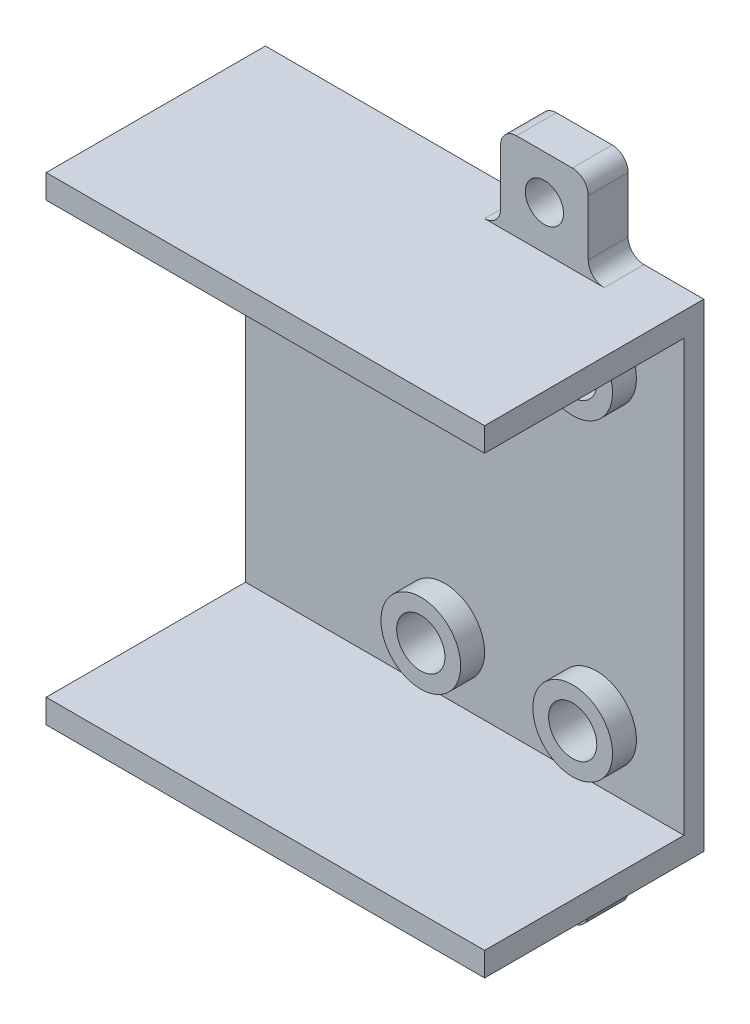
from build123d import *

# Parameters (mm, degrees)
SKETCH1_W            = 55
SKETCH1_H            = 60
BOSS_EXTRUDE1_DEPTH  = 2.5
SKETCH2_W            = 55
SKETCH2_H            = 3
BOSS_EXTRUDE2_DEPTH  = 25
SKETCH3_R            = 5
SKETCH3_R_2          = 3.025
BOSS_EXTRUDE3_DEPTH  = 3
CUT_EXTRUDE1_START   = -2
SKETCH4_R            = 3.025
CUT_EXTRUDE1_DEPTH   = 2
SKETCH5_W            = 11
SKETCH5_H            = 11
BOSS_EXTRUDE4_DEPTH  = 5
M4_CLEARANCE_HOLE1_D = 4.8
FILLET3_R            = 2


with BuildPart() as part:
    # Sketch1 → Boss-Extrude1 (new body)
    with BuildSketch(Plane.XY):
        Rectangle(SKETCH1_W, SKETCH1_H)
    extrude(amount=BOSS_EXTRUDE1_DEPTH)

    # Sketch2 → Boss-Extrude2 (add)
    with BuildSketch(Plane.XY.offset(2.5)):
        with Locations((0, 28.5)):
            Rectangle(SKETCH2_W, SKETCH2_H)
        with Locations((0, -28.5)):
            Rectangle(SKETCH2_W, SKETCH2_H)
    extrude(amount=BOSS_EXTRUDE2_DEPTH)

    # Sketch3 → Boss-Extrude3 (add)
    # profile 1 of 4: a face of its own
    with BuildSketch(Plane.XY.offset(2.5)):
        with Locations((-2.504, 19.6215)):
            Circle(SKETCH3_R)
        with Locations((-2.504, 19.6215)):
            Circle(SKETCH3_R_2, mode=Mode.SUBTRACT)
    # profile 2 of 4: a face of its own
    with BuildSketch(Plane.XY.offset(2.5)):
        with Locations((16.546, 19.6215)):
            Circle(SKETCH3_R)
        with Locations((16.546, 19.6215)):
            Circle(SKETCH3_R_2, mode=Mode.SUBTRACT)
    # profile 3 of 4: a face of its own
    with BuildSketch(Plane.XY.offset(2.5)):
        with Locations((16.546, -19.6215)):
            Circle(SKETCH3_R)
        with Locations((16.546, -19.6215)):
            Circle(SKETCH3_R_2, mode=Mode.SUBTRACT)
    # profile 4 of 4: a face of its own
    with BuildSketch(Plane.XY.offset(2.5)):
        with Locations((-2.504, -19.6215)):
            Circle(SKETCH3_R)
        with Locations((-2.504, -19.6215)):
            Circle(SKETCH3_R_2, mode=Mode.SUBTRACT)
    extrude(amount=BOSS_EXTRUDE3_DEPTH)

    # Sketch4 → Cut-Extrude1 (cut)
    with BuildSketch(Plane.XY.offset(2.5).offset(CUT_EXTRUDE1_START)):
        with Locations((16.546, -19.6215)):
            Circle(SKETCH4_R)
        with Locations((-2.504, -19.6215)):
            Circle(SKETCH4_R)
        with Locations((16.546, 19.6215)):
            Circle(SKETCH4_R)
        with Locations((-2.504, 19.6215)):
            Circle(SKETCH4_R)
    extrude(amount=CUT_EXTRUDE1_DEPTH, mode=Mode.SUBTRACT)

    # Sketch5 → Boss-Extrude4 (add)
    with BuildSketch(Plane(origin=(0, 0, 0), x_dir=(-1, 0, 0), z_dir=(0, 0, -1))):
        with Locations((-12.5, 35.5)):
            Rectangle(SKETCH5_W, SKETCH5_H)
    boss_extrude4 = extrude(amount=-BOSS_EXTRUDE4_DEPTH)

    # M4 Clearance Hole1 (through all)
    with Locations(Plane.XY.offset(5)):
        with Locations((12.5, 35.5)):
            m4_clearance_hole1 = Hole(M4_CLEARANCE_HOLE1_D / 2)

    # Mirror2: Boss-Extrude4, M4 Clearance Hole1 across plane
    add(boss_extrude4.mirror(Plane.ZX))
    add(m4_clearance_hole1.mirror(Plane.ZX), mode=Mode.SUBTRACT)

    # Fillet3
    fillet3_edges = [part.edges().sort_by_distance(p)[0] for p in [
        (18, -30, 2.5),
        (18, -41, 2.5),
        (7, -41, 2.5),
        (7, -30, 2.5),
        (18, 30, 2.5),
        (18, 41, 2.5),
        (7, 41, 2.5),
        (7, 30, 2.5),
    ]]
    fillet(fillet3_edges, radius=FILLET3_R)


solid = part.part
